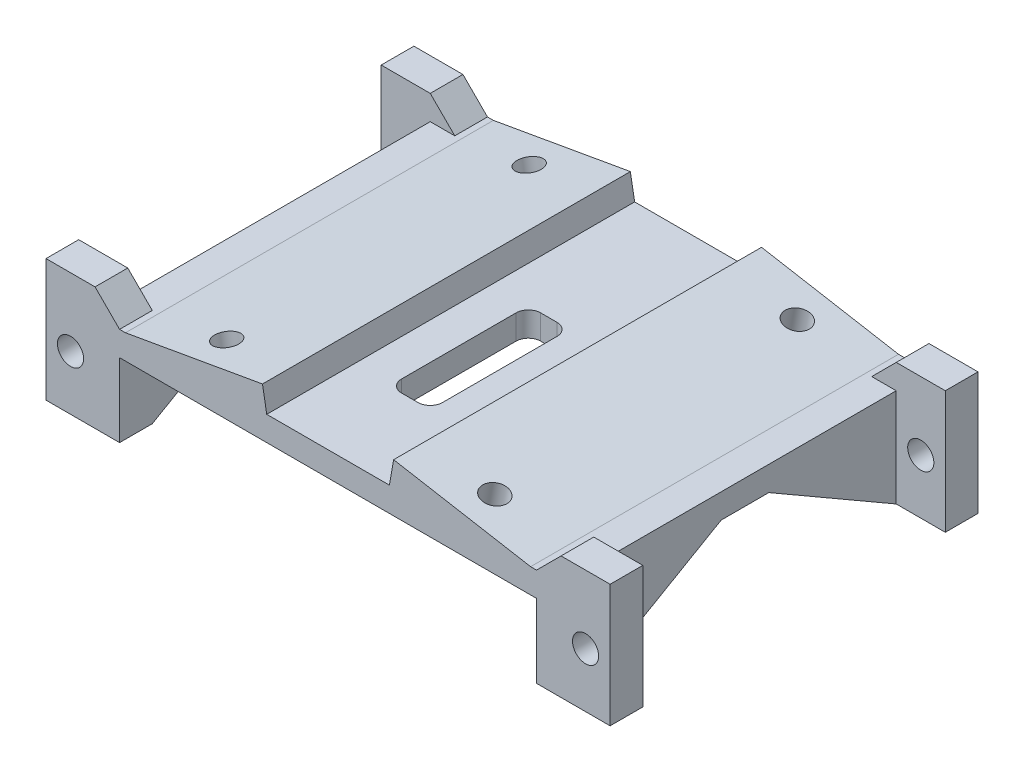
from build123d import *

# Parameters (mm, degrees)
SKETCH_1_W                 = 57
SKETCH_1_H                 = 45
EXTRUDE_1_DEPTH            = 3
SKETCH_2_W                 = 4
SKETCH_2_H                 = 15
EXTRUDE_2_DEPTH            = 6
SKETCH_3_W                 = 4
SKETCH_3_H                 = 15
EXTRUDE_3_DEPTH            = 6
EXTRUDE_4_DEPTH            = 3
SKETCH_5_W                 = 4
SKETCH_5_H                 = 9
EXTRUDE_5_DEPTH            = 3
CHAMFER_1_SIZE             = 3
SKETCH_6_R                 = 1.6
CUT_EXTRUDE_1_DEPTH        = 4
SKETCH_8_W                 = 8
SKETCH_8_H                 = 3
EXTRUDE_6_DEPTH            = 9
EXTRUDE_7_DEPTH            = 3
EXTRUDE_8_DEPTH            = 3
SKETCH_11_R                = 1.6
CUT_EXTRUDE_3_DEPTH        = 3
SKETCH_12_W                = 5
SKETCH_12_H                = 17
CUT_EXTRUDE_4_DEPTH        = 3
FILLET_1_R                 = 1.5
EXTRUDE_9_REACH            = 80.57
SKETCH_15_W                = 45
SKETCH_15_H                = 17.726539555
SKETCH_16_R                = 1.5
CUT_EXTRUDE_5_DEPTH        = 79.570276896
CHAMFER_1_OF_MIRROR_2_SIZE = 3


with BuildPart() as part:
    # 草图1 → 凸台-拉伸1 (new body)
    with BuildSketch(Plane(origin=(0, 0, 0), x_dir=(1, 0, 0), z_dir=(0, 1, 0))):
        with Locations((28.5, 22.5)):
            Rectangle(SKETCH_1_W, SKETCH_1_H)
    extrude(amount=EXTRUDE_1_DEPTH)

    # 草图2 → 凸台-拉伸2 (add)
    with BuildSketch(Plane.ZY):
        with Locations((-2, -1.5)):
            Rectangle(SKETCH_2_W, SKETCH_2_H)
    extrude_2 = extrude(amount=EXTRUDE_2_DEPTH)

    # 草图3 → 凸台-拉伸3 (add)
    with BuildSketch(Plane(origin=(57, 0, 0), x_dir=(0, 0, -1), z_dir=(1, 0, 0))):
        with Locations((2, -1.5)):
            Rectangle(SKETCH_3_W, SKETCH_3_H)
    extrude_3 = extrude(amount=EXTRUDE_3_DEPTH)

    # 草图4 → 凸台-拉伸4 (add)
    with BuildSketch(Plane.ZY.offset(-57)):
        Polygon((-4, -9), (-19.588457268, 0), (0, 0), (0, -9), align=None)
    extrude_4 = extrude(amount=EXTRUDE_4_DEPTH)

    # 草图5 → 凸台-拉伸5 (add)
    with BuildSketch(Plane(origin=(0, 0, 0), x_dir=(0, 0, -1), z_dir=(1, 0, 0))):
        Polygon((19.588457268, 0), (4, 0), (4, -9), align=None)
        with Locations((2, -4.5)):
            Rectangle(SKETCH_5_W, SKETCH_5_H)
    extrude_5 = extrude(amount=EXTRUDE_5_DEPTH)

    # 倒角1
    chamfer_1_edges = [part.edges().sort_by_distance(p)[0] for p in [
        (0, 3, -2),
        (57, 3, -2),
    ]]
    chamfer(chamfer_1_edges, length=CHAMFER_1_SIZE - 0.0001)  # a hair under: the kernel refuses the full size

    # 草图6 → 切除-拉伸1 (cut)
    with BuildSketch(Plane(origin=(0, 0, -4), x_dir=(-1, 0, 0), z_dir=(0, 0, -1))):
        with Locations(Location((3, -2.323268139, 0), (0, 0, 90))):
            Circle(SKETCH_6_R)
        with Locations(Location((-60, -2.323268139, 0), (0, 0, 90))):
            Circle(SKETCH_6_R)
    cut_extrude_1 = extrude(amount=-CUT_EXTRUDE_1_DEPTH, mode=Mode.SUBTRACT)

    # 草图8 → 凸台-拉伸6 (add)
    with BuildSketch(Plane.XZ):
        with Locations((28, -43.5)):
            Rectangle(SKETCH_8_W, SKETCH_8_H)
    extrude(amount=EXTRUDE_6_DEPTH)

    # 草图9 → 凸台-拉伸7 (add)
    with BuildSketch(Plane(origin=(32, 0, 0), x_dir=(0, 0, -1), z_dir=(1, 0, 0))):
        Polygon((45, 0), (29.146667939, 0), (42, -9), (45, -9), align=None)
    extrude(amount=EXTRUDE_7_DEPTH)

    # 草图10 → 凸台-拉伸8 (add)
    with BuildSketch(Plane.ZY.offset(-24)):
        Polygon((-45, 0), (-45, -9), (-42, -9), (-29.146667939, 0), align=None)
    extrude(amount=EXTRUDE_8_DEPTH)

    # 草图11 → 切除-拉伸3 (cut)
    with BuildSketch(Plane.XY.offset(-42)):
        with Locations((28, -4.5)):
            Circle(SKETCH_11_R)
    extrude(amount=-CUT_EXTRUDE_3_DEPTH, mode=Mode.SUBTRACT)

    # 草图12 → 切除-拉伸4 (cut)
    with BuildSketch(Plane(origin=(0, 3, 0), x_dir=(1, 0, 0), z_dir=(0, 1, 0))):
        with Locations((28, 19)):
            Rectangle(SKETCH_12_W, SKETCH_12_H)
    extrude(amount=-CUT_EXTRUDE_4_DEPTH, mode=Mode.SUBTRACT)

    # 圆角1
    fillet_1_edges = [part.edges().sort_by_distance(p)[0] for p in [
        (25.5, 1.5, -27.5),
        (30.5, 1.5, -27.5),
        (30.5, 1.5, -10.5),
        (25.5, 1.5, -10.5),
    ]]
    fillet(fillet_1_edges, radius=FILLET_1_R)

    # 草图15 → 凸台-拉伸9 (add, up to next)
    with BuildSketch(Plane(origin=(2.119507574, 12.02032477, 0), x_dir=(0, 0, 1), z_dir=(0.17364817766693066, 0.9848077530122081, 0)), mode=Mode.PRIVATE) as extrude_9_sk1:
        with Locations((-22.5, 43.795404353)):
            Rectangle(SKETCH_15_W, SKETCH_15_H)
    extrude_9_tool1 = extrude(extrude_9_sk1.sketch, amount=-EXTRUDE_9_REACH, mode=Mode.PRIVATE) - part.part
    extrude_9 = extrude_9_tool1.solids().sort_by_distance((45.249561, 4.415333, -22.5))[0]
    add(extrude_9)

    # 草图16 → 切除-拉伸5 (cut, through all)
    with BuildSketch(Plane(origin=(2.119507574, 12.02032477, 0), x_dir=(0.9848077530122081, -0.17364817766693064, 0), z_dir=(0.17364817766693064, 0.9848077530122081, 0))):
        with Locations(Location((43.439057305, 41, 0), (0, 0, 180))):
            Circle(SKETCH_16_R)
        with Locations((43.439057305, 4)):
            Circle(SKETCH_16_R)
    cut_extrude_5 = extrude(amount=-CUT_EXTRUDE_5_DEPTH, mode=Mode.SUBTRACT)

    # 镜向1: 凸台-拉伸9, 切除-拉伸5 across plane
    add(extrude_9.mirror(Plane(origin=(28.5, 0, 0), x_dir=(0, 0, 1), z_dir=(1, 0, 0))))
    add(cut_extrude_5.mirror(Plane(origin=(28.5, 0, 0), x_dir=(0, 0, 1), z_dir=(1, 0, 0))), mode=Mode.SUBTRACT)

    # 镜向2: 凸台-拉伸2, 凸台-拉伸3, 凸台-拉伸4, 凸台-拉伸5, 切除-拉伸1 across plane
    add(extrude_2.mirror(Plane.XY.offset(-22.5)))
    add(extrude_3.mirror(Plane.XY.offset(-22.5)))
    add(extrude_4.mirror(Plane.XY.offset(-22.5)))
    add(extrude_5.mirror(Plane.XY.offset(-22.5)))
    add(cut_extrude_1.mirror(Plane.XY.offset(-22.5)), mode=Mode.SUBTRACT)

    # 倒角1 of 镜向2
    chamfer_1_of_mirror_2_edges = [part.edges().sort_by_distance(p)[0] for p in [
        (0, 3, -43),
        (57, 3, -43),
    ]]
    chamfer(chamfer_1_of_mirror_2_edges, length=CHAMFER_1_OF_MIRROR_2_SIZE - 0.0001)  # a hair under: the kernel refuses the full size


solid = part.part
